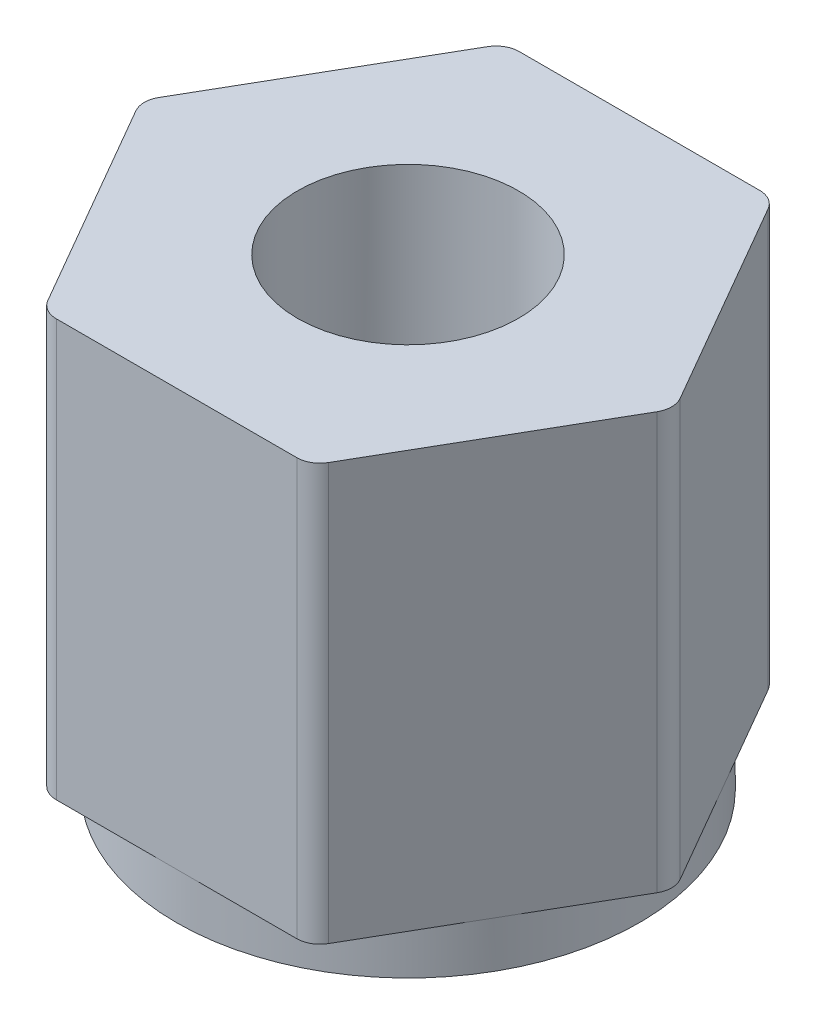
from build123d import *

# Parameters (mm, degrees)
BOSS_EXTRUDE1_DEPTH         = 10
F_3_8_24_TAPPED_HOLE1_D     = 8.4328
F_3_8_24_TAPPED_HOLE1_DEPTH = 4
F_3_8_24_TAPPED_HOLE1_TIP   = 2.533468714
THREAD1_PITCH               = 0.907142857
SKETCH6_R                   = 5.773502692
SKETCH6_R_2                 = 5
CUT_EXTRUDE1_DEPTH          = 1
FILLET1_R                   = 0.5
CUT_EXTRUDE2_REACH          = 14.548
SKETCH7_R                   = 2.3876


with BuildPart() as part:
    # Sketch1 → Boss-Extrude1 (new body)
    with BuildSketch(Plane(origin=(0, 0, 0), x_dir=(1, 0, 0), z_dir=(0, 1, 0))):
        Polygon((5.773502692, 0), (2.886751346, 5), (-2.886751346, 5), (-5.773502692, 0), (-2.886751346, -5), (2.886751346, -5), align=None)
    extrude(amount=BOSS_EXTRUDE1_DEPTH)

    # 3/8-24 Tapped Hole1
    with Locations(Plane(origin=(0, 0, 0), x_dir=(-1, 0, 0), z_dir=(0, -1, 0))):
        with Locations((0, 0)):
            Hole(F_3_8_24_TAPPED_HOLE1_D / 2, depth=F_3_8_24_TAPPED_HOLE1_DEPTH)
            with Locations((0, 0, -(F_3_8_24_TAPPED_HOLE1_DEPTH + F_3_8_24_TAPPED_HOLE1_TIP / 2))):  # 118° drill point
                Cone(0, F_3_8_24_TAPPED_HOLE1_D / 2, F_3_8_24_TAPPED_HOLE1_TIP, mode=Mode.SUBTRACT)

    # Thread1: the profile of Thread Profile1 profile screwed along a right-hand helix of 4.409449 turns, 8 arcs to a turn; built about Z, then put on its axis
    thread1_z = Axis((0, 0, 0), (0, 0, 1))
    thread1_corners = [(4.2161, 0, -0.000173205), (4.707405472, 0, 0.283482142), (4.707405472, 0, 0.396874999), (4.2161, 0, 0.680530345)]
    with BuildLine(mode=Mode.PRIVATE) as thread1_profile:
        Line(thread1_corners[0], thread1_corners[1])
        Line(thread1_corners[1], thread1_corners[2])
        Line(thread1_corners[2], thread1_corners[3])
        Line(thread1_corners[3], thread1_corners[0])
    thread1_cap = Face(thread1_profile.wire())
    thread1_turn_angles = [0, 22.5, 45, 67.5, 90, 112.5, 135, 157.5, 180, 202.5, 225, 247.5, 270, 292.5, 315, 337.5, 360]
    thread1_turn_weights = [1, 0.9238795325112867, 1, 0.9238795325112867, 1, 0.9238795325112867, 1, 0.9238795325112867, 1, 0.9238795325112867, 1, 0.9238795325112867, 1, 0.9238795325112867, 1, 0.9238795325112867, 1]
    thread1_turn_rails = [Edge.make_bspline([Vector(p[0], p[1], 0).rotate(thread1_z, thread1_turn_angles[k]) / thread1_turn_weights[k] + Vector(0, 0, p[2] + THREAD1_PITCH * thread1_turn_angles[k] / 360) for k in range(17)], [0, 0, 0, 1, 1, 2, 2, 3, 3, 4, 4, 5, 5, 6, 6, 7, 7, 8, 8, 8], 2, thread1_turn_weights) for p in thread1_corners]
    thread1_turn_sides = [Face.make_surface_from_curves(thread1_turn_rails[p[0]], thread1_turn_rails[p[1]]) for p in [(0, 1), (1, 2), (2, 3), (3, 0)]]
    thread1_last_angles = [1440, 1462.5, 1485, 1507.5, 1530, 1552.5, 1575, 1581.200787402, 1587.401574803]
    thread1_last_weights = [1, 0.9238795325112867, 1, 0.9238795325112867, 1, 0.9238795325112867, 1, 0.9941494796702888, 1]
    thread1_last_rails = [Edge.make_bspline([Vector(p[0], p[1], 0).rotate(thread1_z, thread1_last_angles[k]) / thread1_last_weights[k] + Vector(0, 0, p[2] + THREAD1_PITCH * thread1_last_angles[k] / 360) for k in range(9)], [0, 0, 0, 1, 1, 2, 2, 3, 3, 4, 4, 4], 2, thread1_last_weights) for p in thread1_corners]
    thread1_last_sides = [Face.make_surface_from_curves(thread1_last_rails[p[0]], thread1_last_rails[p[1]]) for p in [(0, 1), (1, 2), (2, 3), (3, 0)]]
    thread1 = Plane(origin=(0, 0, 0), x_dir=(1, 0, 0), z_dir=(0, 1, 0)) * Solid(Shell([*[p.moved(Location((0, 0, THREAD1_PITCH * i))) for i in range(4) for p in thread1_turn_sides], *thread1_last_sides, thread1_cap, thread1_cap.rotate(thread1_z, 1587.401574803).moved(Location((0, 0, THREAD1_PITCH * 1587.401574803 / 360)))]))
    add(thread1, mode=Mode.SUBTRACT)

    # Sketch6 → Cut-Extrude1 (cut)
    with BuildSketch(Plane.XZ):
        Circle(SKETCH6_R)
        with Locations(Location((0, 0, 0), (0, 0, 90))):
            Circle(SKETCH6_R_2, mode=Mode.SUBTRACT)
    extrude(amount=-CUT_EXTRUDE1_DEPTH, mode=Mode.SUBTRACT)

    # Fillet1
    fillet1_edges = [part.edges().sort_by_distance(p)[0] for p in [
        (2.886751346, 5.5, 5),
        (-2.886751346, 5.5, 5),
        (-5.773502692, 5.5, 0),
        (-2.886751346, 5.5, -5),
        (2.886751346, 5.5, -5),
        (5.773502692, 5.5, 0),
    ]]
    fillet(fillet1_edges, radius=FILLET1_R)

    # Cut-Extrude2: up to this cone (the profile starts outside it)
    cut_extrude2_end = Plane(origin=(0, 10, 0), z_dir=(0, -1, 0)).offset(3.466532286) * Cone(1.664e-06, 19.274800756, 11.581467714, align=(Align.CENTER, Align.CENTER, Align.MIN), mode=Mode.PRIVATE)
    # Sketch7 → Cut-Extrude2 (cut, up to the surface)
    with BuildSketch(Plane(origin=(0, 10, 0), x_dir=(1, 0, 0), z_dir=(0, 1, 0)), mode=Mode.PRIVATE) as cut_extrude2_sk1:
        with Locations(Location((0, 0, 0), (0, 0, 270))):
            Circle(SKETCH7_R)
    cut_extrude2_tool1 = extrude(cut_extrude2_sk1.sketch, amount=-CUT_EXTRUDE2_REACH, mode=Mode.PRIVATE) - cut_extrude2_end
    add(cut_extrude2_tool1.solids().sort_by_distance((0, 10, 0))[0], mode=Mode.SUBTRACT)


solid = part.part
